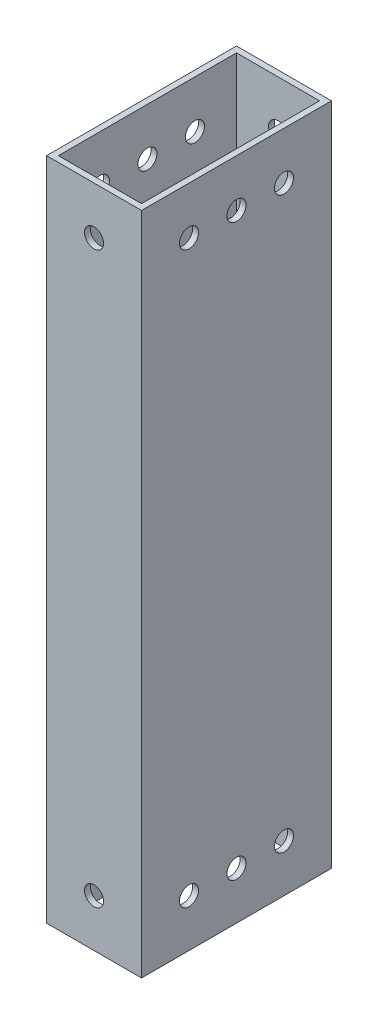
from build123d import *

# Parameters (mm, degrees)
SKETCH1_W              = 25.4
SKETCH1_H              = 50.8
SKETCH1_W_2            = 22.225
SKETCH1_H_2            = 47.625
EXTRUDE_THIN1_DEPTH    = 177.8
F_10_CLEARANCE_HOLE1_D = 5.1054
F_10_CLEARANCE_HOLE2_D = 5.1054


with BuildPart() as part:
    # Sketch1 → Extrude-Thin1 (new body)
    with BuildSketch(Plane(origin=(0, 0, 0), x_dir=(1, 0, 0), z_dir=(0, 1, 0))):
        Rectangle(SKETCH1_W, SKETCH1_H)
        Rectangle(SKETCH1_W_2, SKETCH1_H_2, mode=Mode.SUBTRACT)
    extrude(amount=EXTRUDE_THIN1_DEPTH)

    # #10 Clearance Hole1 (through all)
    with Locations(Plane.ZY.offset(12.7)):
        with Locations((-12.7, 12.7), (0, 12.7), (12.7, 12.7), (-12.7, 165.1), (12.7, 165.1), (0, 165.1)):
            Hole(F_10_CLEARANCE_HOLE1_D / 2)

    # #10 Clearance Hole2 (through all)
    with Locations(Plane.XY.offset(25.4)):
        with Locations((0, 12.7), (0, 165.1)):
            Hole(F_10_CLEARANCE_HOLE2_D / 2)


solid = part.part
